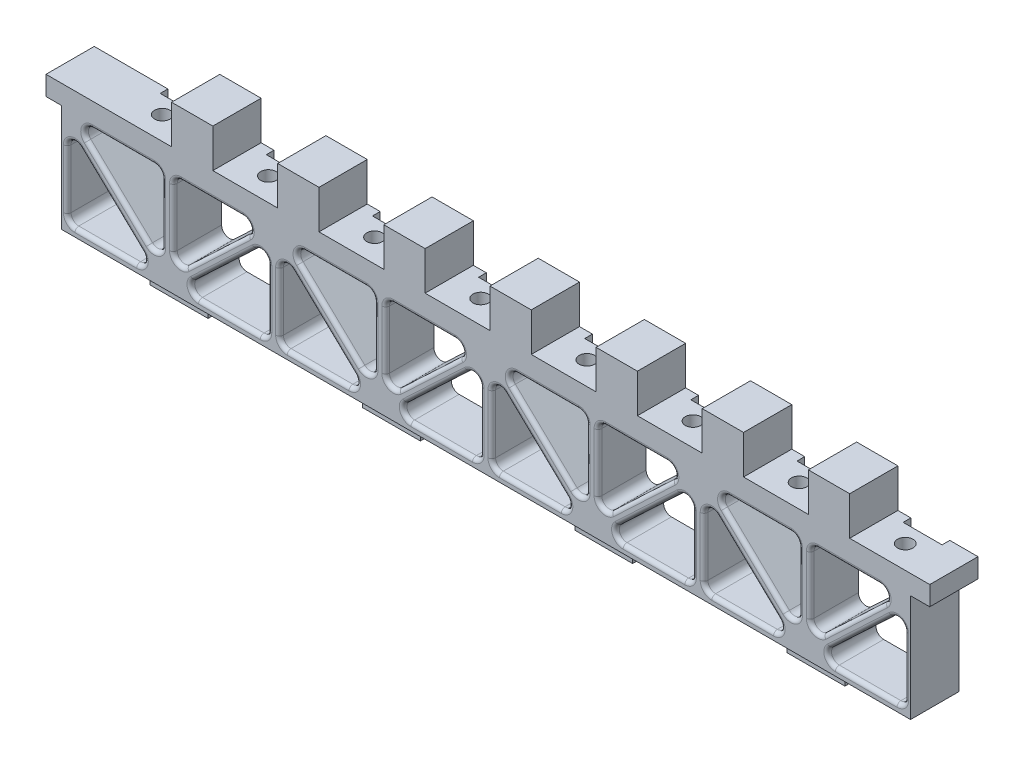
from build123d import *

# Parameters (mm, degrees)
SKETCH1_W              = 228.98
SKETCH1_H              = 12.5
BOSS_EXTRUDE1_DEPTH    = 5
SKETCH2_W              = 10.1
SKETCH2_H              = 2
CUT_EXTRUDE1_DEPTH     = 3.05
SKETCH3_R              = 2
CUT_EXTRUDE2_DEPTH     = 4
LPATTERN1_COUNT        = 8
LPATTERN1_PITCH        = 27.5
BOSS_EXTRUDE2_DEPTH    = 12.5
FILLET1_R              = 2
FILLET2_R              = 1
SKETCH5_W              = 15
SKETCH5_H              = 6.5
BOSS_EXTRUDE3_DEPTH    = 4
LPATTERN2_COUNT        = 4
LPATTERN2_PITCH        = 55
FILLET1_OF_LPATTERN2_R = 2
FILLET2_OF_LPATTERN2_R = 1
SKETCH6_W              = 10.7
SKETCH6_H              = 12.5
BOSS_EXTRUDE4_DEPTH    = 10
LPATTERN3_COUNT        = 7
LPATTERN3_PITCH        = 27.5


with BuildPart() as part:
    # Sketch1 → Boss-Extrude1 (new body)
    with BuildSketch(Plane(origin=(0, 0, 0), x_dir=(1, 0, 0), z_dir=(0, 1, 0))):
        with Locations((114.49, 6.25)):
            Rectangle(SKETCH1_W, SKETCH1_H)
    extrude(amount=BOSS_EXTRUDE1_DEPTH)

    # Sketch2 → Cut-Extrude1 (cut)
    with BuildSketch(Plane(origin=(0, 5, 0), x_dir=(1, 0, 0), z_dir=(0, 1, 0))):
        with Locations((24.13, 11.5)):
            Rectangle(SKETCH2_W, SKETCH2_H)
    cut_extrude1 = extrude(amount=-CUT_EXTRUDE1_DEPTH, mode=Mode.SUBTRACT)

    # Sketch3 → Cut-Extrude2 (cut)
    with BuildSketch(Plane(origin=(0, 5, 0), x_dir=(1, 0, 0), z_dir=(0, 1, 0))):
        with Locations((24.13, 6)):
            Circle(SKETCH3_R)
    cut_extrude2 = extrude(amount=-CUT_EXTRUDE2_DEPTH, mode=Mode.SUBTRACT)

    # LPattern1: Cut-Extrude1, Cut-Extrude2 ×8
    with Locations(*[(i * LPATTERN1_PITCH, 0, 0) for i in range(1, LPATTERN1_COUNT)]):
        add(cut_extrude1, mode=Mode.SUBTRACT)
        add(cut_extrude2, mode=Mode.SUBTRACT)

    # Sketch4 → Boss-Extrude2 (add)
    with BuildSketch(Plane.XY):
        Polygon((4, 0.20458934), (31.5, 0.20458934), (31.5, 0), (59, 0), (59, -27.79541066), (31.5, -27.79541066), (4, -27.79541066), align=None)
        Polygon((30, -1.29541066), (7, -1.29541066), (30, -23.197334449), align=None, mode=Mode.SUBTRACT)
        Polygon((5.5, -3.893486871), (5.5, -25.79541066), (28.5, -25.79541066), align=None, mode=Mode.SUBTRACT)
        Polygon((33, -1.5), (33, -23.197334449), (56, -1.5), align=None, mode=Mode.SUBTRACT)
        Polygon((34.5, -25.79541066), (57.5, -25.79541066), (57.5, -4.098076211), align=None, mode=Mode.SUBTRACT)
    boss_extrude2 = extrude(amount=-BOSS_EXTRUDE2_DEPTH)

    # Fillet1
    fillet1_edges = [part.edges().sort_by_distance(p)[0] for p in [
        (57.5, -25.79541066, -6.25),
        (57.5, -4.098076211, -6.25),
        (30, -1.29541066, -6.25),
        (33, -1.5, -6.25),
        (56, -1.5, -6.25),
        (5.5, -25.79541066, -6.25),
        (5.5, -3.893486871, -6.25),
        (7, -1.29541066, -6.25),
        (34.5, -25.79541066, -6.25),
        (28.5, -25.79541066, -6.25),
        (30, -23.197334449, -6.25),
        (33, -23.197334449, -6.25),
    ]]
    fillet(fillet1_edges, radius=FILLET1_R)

    # Fillet2
    fillet2_edges = [part.edges().sort_by_distance(p)[0] for p in [
        (25.356508228, -24.538131931, 0),
        (15.499765407, -25.79541066, 0),
        (6.085786438, -25.209624222, 0),
        (5.5, -16.177573605, 0),
        (6.712101925, -6.721471981, 0),
        (56.292202758, -6.897883737, 0),
        (57.5, -16.264853982, 0),
        (56.914213562, -25.209624222, 0),
        (47.517323418, -25.79541066, 0),
        (37.675934408, -24.533779205, 0),
        (34.207797242, -20.397526923, 0),
        (33, -11.030556678, 0),
        (33.585786438, -2.085786438, 0),
        (42.982676582, -1.5, 0),
        (52.824065592, -2.761631455, 0),
        (28.787898075, -20.369349339, 0),
        (18.621017969, -12.36161283, 0),
        (10.143491772, -2.55268939, 0),
        (20.000234593, -1.29541066, 0),
        (29.414213562, -1.881197098, 0),
        (16.878982031, -14.72920849, 0),
        (46.144908627, -14.81004209, 0),
        (44.355091373, -12.48536857, 0),
        (30, -10.913247715, 0),
    ]]
    fillet(fillet2_edges, radius=FILLET2_R)

    # Sketch5 → Boss-Extrude3 (add)
    with BuildSketch(Plane.XZ.offset(27.79541066)):
        with Locations((31.5, -6.25)):
            Rectangle(SKETCH5_W, SKETCH5_H)
    boss_extrude3 = extrude(amount=BOSS_EXTRUDE3_DEPTH)

    # LPattern2: Boss-Extrude2, Boss-Extrude3 ×4
    with Locations(*[(i * LPATTERN2_PITCH, 0, 0) for i in range(1, LPATTERN2_COUNT)]):
        add(boss_extrude2)
        add(boss_extrude3)

    # Fillet1 of LPattern2
    fillet1_of_lpattern2_edges = [part.edges().sort_by_distance(p)[0] for p in [
        (112.5, -25.79541066, -6.25),
        (112.5, -4.098076211, -6.25),
        (85, -1.29541066, -6.25),
        (88, -1.5, -6.25),
        (111, -1.5, -6.25),
        (60.5, -25.79541066, -6.25),
        (60.5, -3.893486871, -6.25),
        (62, -1.29541066, -6.25),
        (89.5, -25.79541066, -6.25),
        (83.5, -25.79541066, -6.25),
        (85, -23.197334449, -6.25),
        (88, -23.197334449, -6.25),
        (167.5, -25.79541066, -6.25),
        (167.5, -4.098076211, -6.25),
        (140, -1.29541066, -6.25),
        (143, -1.5, -6.25),
        (166, -1.5, -6.25),
        (115.5, -25.79541066, -6.25),
        (115.5, -3.893486871, -6.25),
        (117, -1.29541066, -6.25),
        (144.5, -25.79541066, -6.25),
        (138.5, -25.79541066, -6.25),
        (140, -23.197334449, -6.25),
        (143, -23.197334449, -6.25),
        (222.5, -25.79541066, -6.25),
        (222.5, -4.098076211, -6.25),
        (195, -1.29541066, -6.25),
        (198, -1.5, -6.25),
        (221, -1.5, -6.25),
        (170.5, -25.79541066, -6.25),
        (170.5, -3.893486871, -6.25),
        (172, -1.29541066, -6.25),
        (199.5, -25.79541066, -6.25),
        (193.5, -25.79541066, -6.25),
        (195, -23.197334449, -6.25),
        (198, -23.197334449, -6.25),
    ]]
    fillet(fillet1_of_lpattern2_edges, radius=FILLET1_OF_LPATTERN2_R)

    # Fillet2 of LPattern2
    fillet2_of_lpattern2_edges = [part.edges().sort_by_distance(p)[0] for p in [
        (80.356508228, -24.538131931, 0),
        (70.499765407, -25.79541066, 0),
        (61.085786438, -25.209624222, 0),
        (60.5, -16.177573605, 0),
        (61.712101925, -6.721471981, 0),
        (111.292202758, -6.897883737, 0),
        (112.5, -16.264853982, 0),
        (111.914213562, -25.209624222, 0),
        (102.517323418, -25.79541066, 0),
        (92.675934408, -24.533779205, 0),
        (89.207797242, -20.397526923, 0),
        (88, -11.030556678, 0),
        (88.585786438, -2.085786438, 0),
        (97.982676582, -1.5, 0),
        (107.824065592, -2.761631455, 0),
        (83.787898075, -20.369349339, 0),
        (73.621017969, -12.36161283, 0),
        (65.143491772, -2.55268939, 0),
        (75.000234593, -1.29541066, 0),
        (84.414213562, -1.881197098, 0),
        (71.878982031, -14.72920849, 0),
        (101.144908627, -14.81004209, 0),
        (99.355091373, -12.48536857, 0),
        (85, -10.913247715, 0),
        (135.356508228, -24.538131931, 0),
        (125.499765407, -25.79541066, 0),
        (116.085786438, -25.209624222, 0),
        (115.5, -16.177573605, 0),
        (116.712101925, -6.721471981, 0),
        (166.292202758, -6.897883737, 0),
        (167.5, -16.264853982, 0),
        (166.914213562, -25.209624222, 0),
        (157.517323418, -25.79541066, 0),
        (147.675934408, -24.533779205, 0),
        (144.207797242, -20.397526923, 0),
        (143, -11.030556678, 0),
        (143.585786438, -2.085786438, 0),
        (152.982676582, -1.5, 0),
        (162.824065592, -2.761631455, 0),
        (138.787898075, -20.369349339, 0),
        (128.621017969, -12.36161283, 0),
        (120.143491772, -2.55268939, 0),
        (130.000234593, -1.29541066, 0),
        (139.414213562, -1.881197098, 0),
        (126.878982031, -14.72920849, 0),
        (156.144908627, -14.81004209, 0),
        (154.355091373, -12.48536857, 0),
        (140, -10.913247715, 0),
        (190.356508228, -24.538131931, 0),
        (180.499765407, -25.79541066, 0),
        (171.085786438, -25.209624222, 0),
        (170.5, -16.177573605, 0),
        (171.712101925, -6.721471981, 0),
        (221.292202758, -6.897883737, 0),
        (222.5, -16.264853982, 0),
        (221.914213562, -25.209624222, 0),
        (212.517323418, -25.79541066, 0),
        (202.675934408, -24.533779205, 0),
        (199.207797242, -20.397526923, 0),
        (198, -11.030556678, 0),
        (198.585786438, -2.085786438, 0),
        (207.982676582, -1.5, 0),
        (217.824065592, -2.761631455, 0),
        (193.787898075, -20.369349339, 0),
        (183.621017969, -12.36161283, 0),
        (175.143491772, -2.55268939, 0),
        (185.000234593, -1.29541066, 0),
        (194.414213562, -1.881197098, 0),
        (181.878982031, -14.72920849, 0),
        (211.144908627, -14.81004209, 0),
        (209.355091373, -12.48536857, 0),
        (195, -10.913247715, 0),
    ]]
    fillet(fillet2_of_lpattern2_edges, radius=FILLET2_OF_LPATTERN2_R)

    # Sketch6 → Boss-Extrude4 (add)
    with BuildSketch(Plane(origin=(0, 5, 0), x_dir=(1, 0, 0), z_dir=(0, 1, 0))):
        with Locations((37.88, 6.25)):
            Rectangle(SKETCH6_W, SKETCH6_H)
    boss_extrude4 = extrude(amount=BOSS_EXTRUDE4_DEPTH)

    # LPattern3: Boss-Extrude4 ×7
    with Locations(*[(i * LPATTERN3_PITCH, 0, 0) for i in range(1, LPATTERN3_COUNT)]):
        add(boss_extrude4)


solid = part.part
